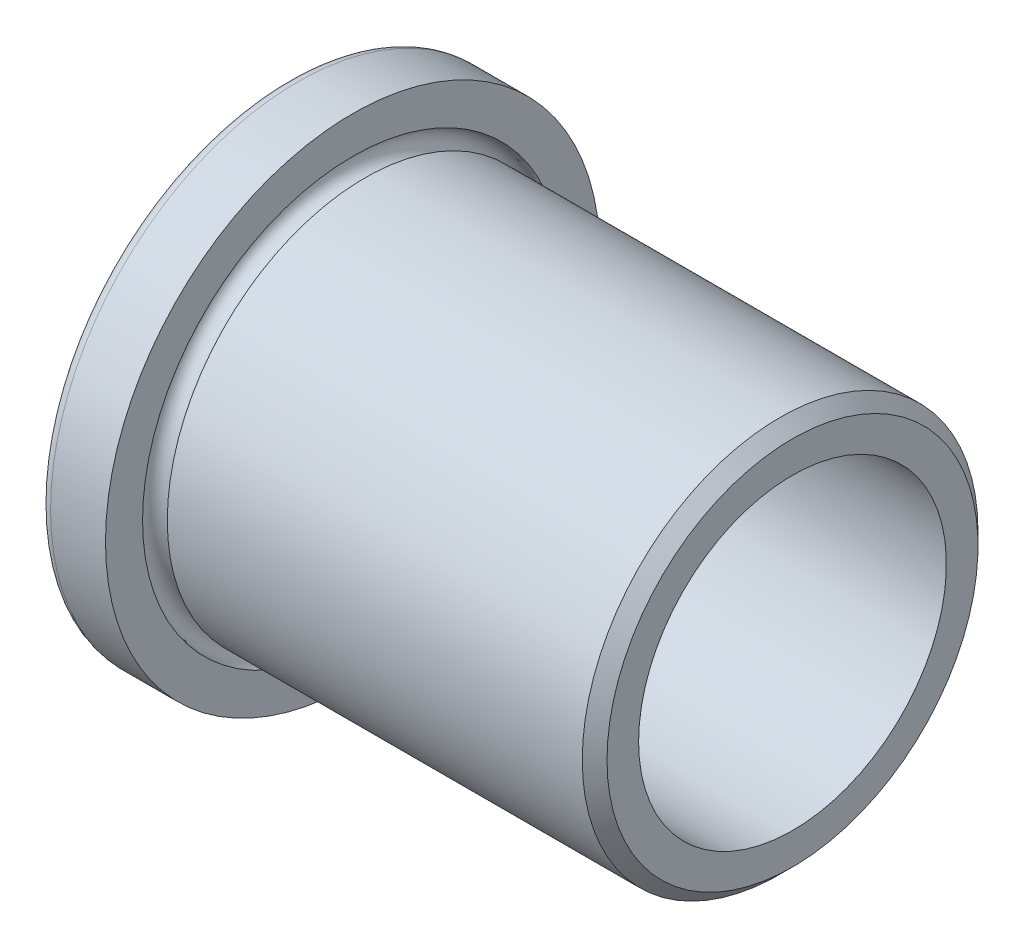
from build123d import *


with BuildPart() as part:
    # Sketch1 → BaseBody (revolve)
    with BuildSketch(Plane.XY):
        with BuildLine():
            Line((0, 25.4), (0, 34.1249))
            ThreePointArc((0, 34.1249), (0.464967985, 35.247432015), (1.5875, 35.7124))
            Line((1.5875, 35.7124), (9.525, 35.7124))
            Line((9.525, 35.7124), (9.525, 30.35935))
            ThreePointArc((9.525, 30.35935), (8.263274015, 27.313274015), (11.30935, 28.575))
            Line((11.30935, 28.575), (71.2390625, 28.575))
            Line((71.2390625, 28.575), (73.025, 26.7890625))
            Line((73.025, 26.7890625), (73.025, 22.225))
            Line((73.025, 22.225), (3.175, 22.225))
            ThreePointArc((3.175, 22.225), (0.92993597, 23.15493597), (0, 25.4))
        make_face()
    revolve(axis=Axis((0, 0, 0), (1, 0, 0)))


solid = part.part
